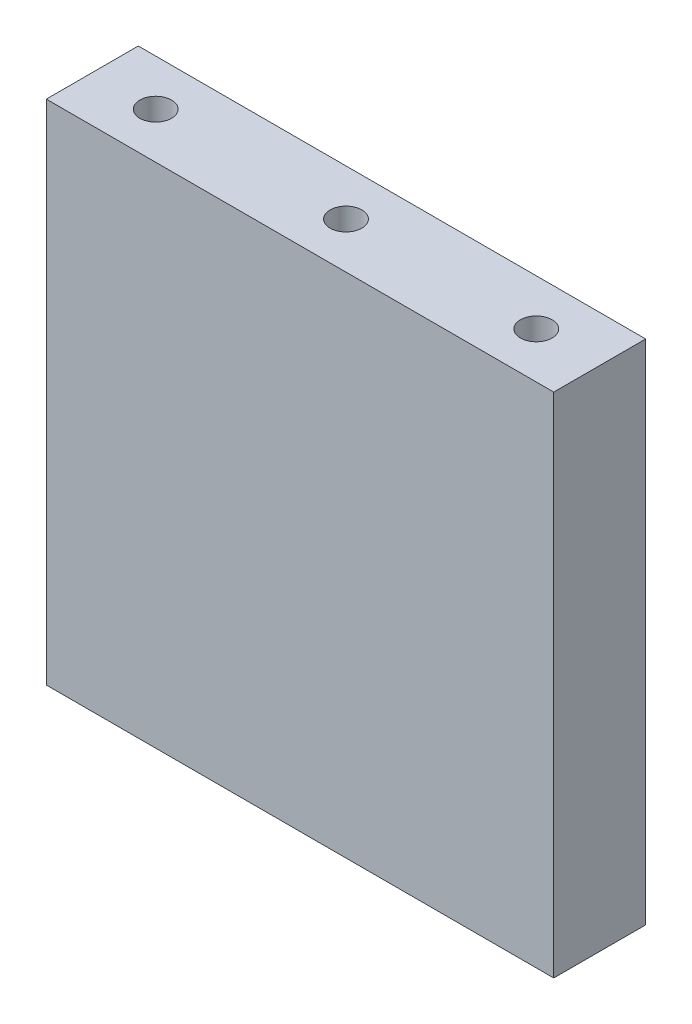
from build123d import *

# Parameters (mm, degrees)
SKETCH1_W           = 101.6
SKETCH1_H           = 18.415
BOSS_EXTRUDE1_DEPTH = 101.6
SKETCH2_R           = 3.175
CUT_EXTRUDE1_DEPTH  = 12.7
CUT_EXTRUDE2_START  = -12.7
SKETCH3_R           = 3.175
CUT_EXTRUDE2_DEPTH  = 12.7


with BuildPart() as part:
    # Sketch1 → Boss-Extrude1 (new body)
    with BuildSketch(Plane(origin=(0, 0, 0), x_dir=(1, 0, 0), z_dir=(0, 1, 0))):
        with Locations((50.8, 9.2075)):
            Rectangle(SKETCH1_W, SKETCH1_H)
    extrude(amount=BOSS_EXTRUDE1_DEPTH)

    # Sketch2 → Cut-Extrude1 (cut)
    with BuildSketch(Plane(origin=(0, 101.6, 0), x_dir=(1, 0, 0), z_dir=(0, 1, 0))):
        with Locations((12.7, 9.2075)):
            Circle(SKETCH2_R)
        with Locations((88.9, 9.2075)):
            Circle(SKETCH2_R)
        with Locations((50.8, 9.2075)):
            Circle(SKETCH2_R)
    extrude(amount=-CUT_EXTRUDE1_DEPTH, mode=Mode.SUBTRACT)

    # Sketch3 → Cut-Extrude2 (cut)
    with BuildSketch(Plane.XZ.offset(CUT_EXTRUDE2_START)):
        with Locations((50.8, -9.2075)):
            Circle(SKETCH3_R)
        with Locations((88.9, -9.2075)):
            Circle(SKETCH3_R)
        with Locations((12.7, -9.2075)):
            Circle(SKETCH3_R)
    extrude(amount=CUT_EXTRUDE2_DEPTH, mode=Mode.SUBTRACT)


solid = part.part
